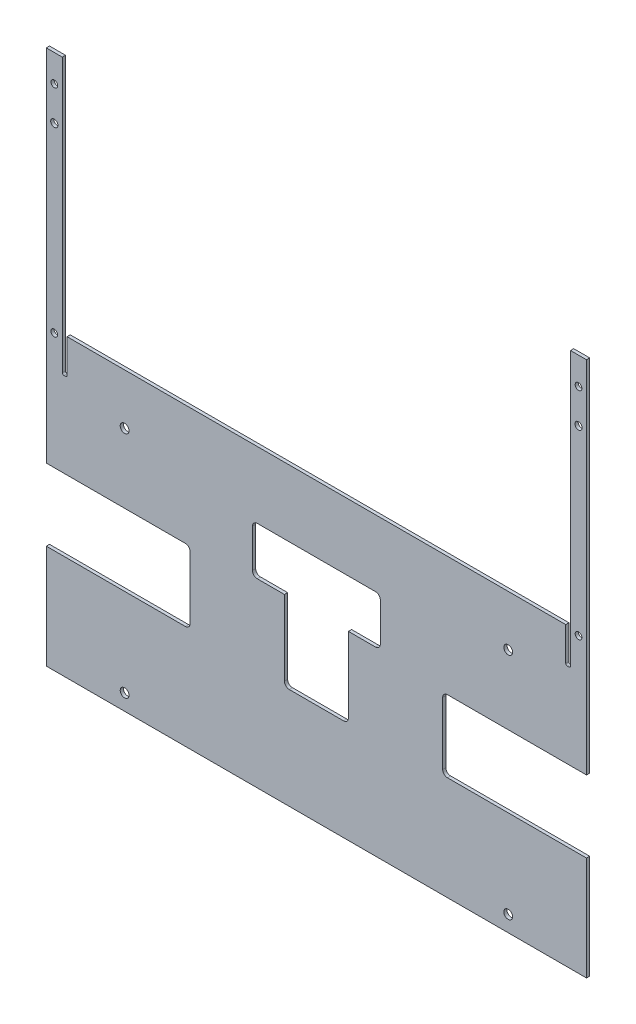
from build123d import *

# Parameters (mm, degrees)
ESQUISSE1_W             = 338
ESQUISSE1_H             = 335
BOSS_EXTRU_1_DEPTH      = 2
ESQUISSE2_W             = 318
ESQUISSE2_H             = 150
ESQUISSE2_W_2           = 90
ESQUISSE2_H_2           = 45
ENL_V_MAT_EXTRU_1_DEPTH = 238.952201082
ESQUISSE7_R             = 2.75
ENL_V_MAT_EXTRU_4_DEPTH = 238.952201082
D_GAGEMENT_M41_D        = 4.5
ESQUISSE5_W             = 3
ESQUISSE5_H             = 22
ENL_V_MAT_EXTRU_2_DEPTH = 238.952201082
ESQUISSE6_R             = 2.1
ENL_V_MAT_EXTRU_3_DEPTH = 238.952201082
ENL_V_MAT_EXTRU_5_DEPTH = 10
CONG_1_R                = 1
CONG_2_R                = 3


with BuildPart() as part:
    # Esquisse1 → Boss.-Extru.1 (new body)
    with BuildSketch(Plane.XY):
        Rectangle(ESQUISSE1_W, ESQUISSE1_H)
    extrude(amount=BOSS_EXTRU_1_DEPTH)

    # Esquisse2 → Enlèv. mat.-Extru.1 (cut, through all)
    with BuildSketch(Plane.XY.offset(2)):
        with Locations((0, 92.5)):
            Rectangle(ESQUISSE2_W, ESQUISSE2_H)
        with Locations((124, -80)):
            Rectangle(ESQUISSE2_W_2, ESQUISSE2_H_2)
        with Locations((-124, -80)):
            Rectangle(ESQUISSE2_W_2, ESQUISSE2_H_2)
    extrude(amount=-ENL_V_MAT_EXTRU_1_DEPTH, mode=Mode.SUBTRACT)

    # Esquisse7 → Enlèv. mat.-Extru.4 (cut, through all)
    with BuildSketch(Plane.XY.offset(2)):
        with Locations((-120, -157.5)):
            Circle(ESQUISSE7_R)
        with Locations((-120, -14.17)):
            Circle(ESQUISSE7_R)
        with Locations((120, -14.17)):
            Circle(ESQUISSE7_R)
        with Locations((120, -157.5)):
            Circle(ESQUISSE7_R)
    extrude(amount=-ENL_V_MAT_EXTRU_4_DEPTH, mode=Mode.SUBTRACT)

    # Dégagement M41 (through all)
    with Locations(Plane.XY.offset(2)):
        with Locations((164, 129.17), (-164, 129.17)):
            Hole(D_GAGEMENT_M41_D / 2)

    # Esquisse5 → Enlèv. mat.-Extru.2 (cut, through all)
    with BuildSketch(Plane.XY.offset(2)):
        with Locations((157.5, 6.5)):
            Rectangle(ESQUISSE5_W, ESQUISSE5_H)
        with Locations((-157.5, 6.5)):
            Rectangle(ESQUISSE5_W, ESQUISSE5_H)
    extrude(amount=-ENL_V_MAT_EXTRU_2_DEPTH, mode=Mode.SUBTRACT)

    # Esquisse6 → Enlèv. mat.-Extru.3 (cut, through all)
    with BuildSketch(Plane.XY.offset(2)):
        with Locations((-164, 15.5)):
            Circle(ESQUISSE6_R)
        with Locations((-164, 150.5)):
            Circle(ESQUISSE6_R)
        with Locations((164, 15.5)):
            Circle(ESQUISSE6_R)
        with Locations((164, 150.5)):
            Circle(ESQUISSE6_R)
    extrude(amount=-ENL_V_MAT_EXTRU_3_DEPTH, mode=Mode.SUBTRACT)

    # Esquisse8 → Enlèv. mat.-Extru.5 (cut)
    with BuildSketch(Plane.XY.offset(2)):
        Polygon((20, -54.17), (40, -54.17), (40, -24.17), (-40, -24.17), (-40, -54.17), (-20, -54.17), (-20, -104.17), (20, -104.17), align=None)
    extrude(amount=-ENL_V_MAT_EXTRU_5_DEPTH, mode=Mode.SUBTRACT)

    # Congé1
    cong_1_edges = [part.edges().sort_by_distance(p)[0] for p in [
        (156, -4.5, 1),
        (159, -4.5, 1),
        (-156, -4.5, 1),
        (-159, -4.5, 1),
    ]]
    fillet(cong_1_edges, radius=CONG_1_R)

    # Congé2
    cong_2_edges = [part.edges().sort_by_distance(p)[0] for p in [
        (79, -57.5, 1),
        (79, -102.5, 1),
        (-40, -54.17, 1),
        (-20, -104.17, 1),
        (20, -104.17, 1),
        (40, -54.17, 1),
        (40, -24.17, 1),
        (-40, -24.17, 1),
        (-79, -102.5, 1),
        (-79, -57.5, 1),
    ]]
    fillet(cong_2_edges, radius=CONG_2_R)


solid = part.part
